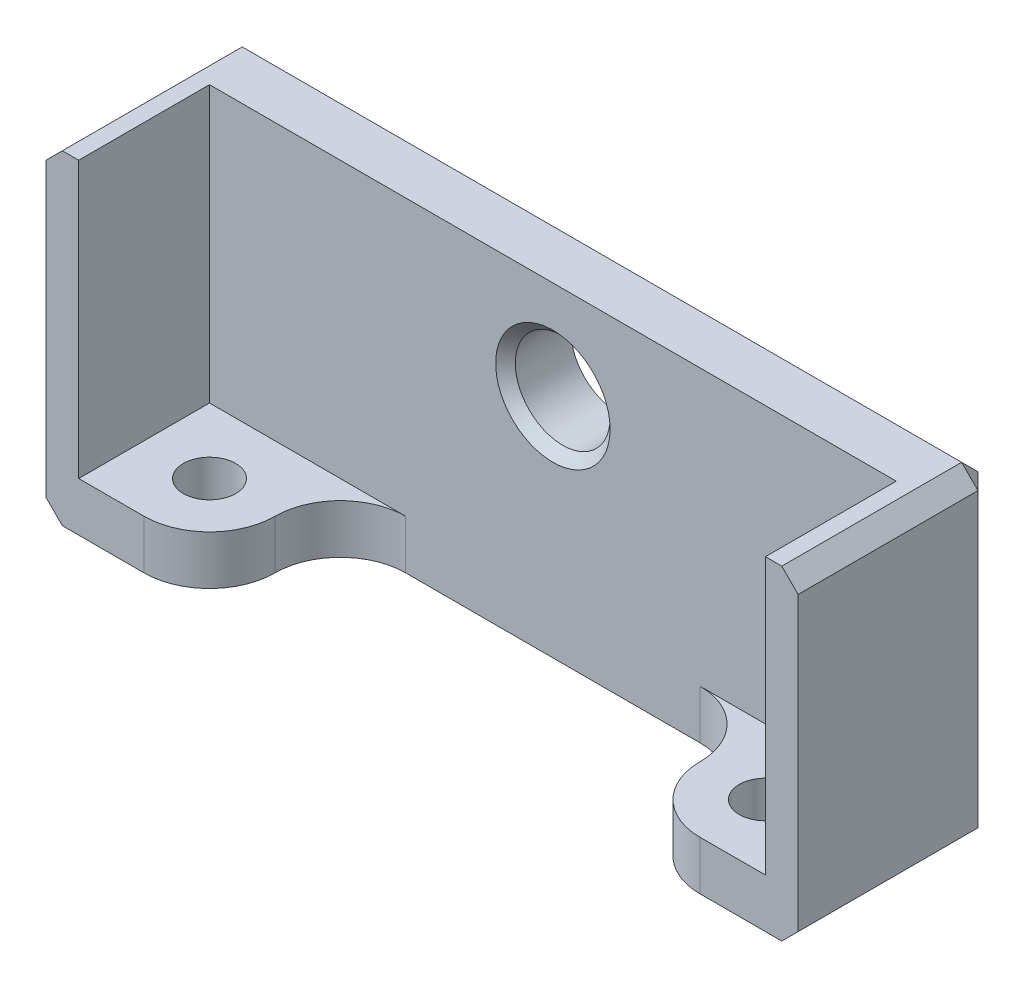
from build123d import *

# Parameters (mm, degrees)
SKETCH_1_R       = 2.9
EXTRUDE_1_DEPTH  = 4
CHAMFER_1_SIZE   = 0.6
SKETCH_3_W       = 12
SKETCH_3_H       = 19.86
EXTRUDE_2_DEPTH  = 2
SKETCH_4_W       = 10
SKETCH_4_H       = 12
SKETCH_4_R       = 1.6
EXTRUDE_3_DEPTH  = 3
FILLET_START     = -15
FILLET_2_DEPTH   = 4.14
FILLET_START_2   = -13.86
FILLET_2_2_DEPTH = 3
CHAMFER_4_SIZE   = 1


with BuildPart() as part:
    # 草图1 → 凸台-拉伸1 (new body)
    with BuildSketch(Plane.XY):
        Polygon((7.937253933, 6), (-21, 6), (-21, -13.86), (7.937253933, -13.86), (21, -13.86), (21, 6), align=None)
        Circle(SKETCH_1_R, mode=Mode.SUBTRACT)
    extrude(amount=EXTRUDE_1_DEPTH)

    # 倒角1
    chamfer_1_edges = [part.edges().sort_by_distance(p)[0] for p in [
        (-2.9, 0, 4),
    ]]
    chamfer(chamfer_1_edges, length=CHAMFER_1_SIZE)

    # 草图3 → 凸台-拉伸2 (add)
    with BuildSketch(Plane.ZY.offset(21)):
        with Locations((6, -3.93)):
            Rectangle(SKETCH_3_W, SKETCH_3_H)
    extrude_2 = extrude(amount=EXTRUDE_2_DEPTH)

    # 镜向1: 凸台-拉伸2 across plane
    add(extrude_2.mirror(Plane(origin=(0, 0, 0), x_dir=(0, 0, 1), z_dir=(1, 0, 0))))

    # 草图4 → 凸台-拉伸3 (add)
    # profile 1 of 2: a face of its own
    with BuildSketch(Plane.XZ.offset(13.86)):
        with Locations((-18, 6)):
            Rectangle(SKETCH_4_W, SKETCH_4_H)
        with Locations((-17, 8)):
            Circle(SKETCH_4_R, mode=Mode.SUBTRACT)
    # profile 2 of 2: a face of its own
    with BuildSketch(Plane.XZ.offset(13.86)):
        with Locations((18, 6)):
            Rectangle(SKETCH_4_W, SKETCH_4_H)
        with Locations(Location((17, 8, 0), (0, 0, 180))):
            Circle(SKETCH_4_R, mode=Mode.SUBTRACT)
    extrude(amount=-EXTRUDE_3_DEPTH)

    # 圆角2: read off the stored shape, not the designer's step
    # 圆角2 outline → 圆角2 (cut)
    with BuildSketch(Plane(origin=(0, 0, 0), x_dir=(1, 0, 0), z_dir=(0, 1, 0)).offset(FILLET_START)):
        with BuildLine():
            Line((13, -12), (17, -12))
            ThreePointArc((17, -12), (14.171572875, -10.828427125), (13, -8))
            Line((13, -8), (13, -12))
        make_face()
        with BuildLine():
            Line((-13, -12), (-13, -8))
            ThreePointArc((-13, -8), (-14.171572875, -10.828427125), (-17, -12))
            Line((-17, -12), (-13, -12))
        make_face()
    extrude(amount=FILLET_2_DEPTH, mode=Mode.SUBTRACT)

    # Fillet 2 2 outline → Fillet 2 2 (add)
    with BuildSketch(Plane(origin=(0, 0, 0), x_dir=(1, 0, 0), z_dir=(0, 1, 0)).offset(FILLET_START_2)):
        with BuildLine():
            ThreePointArc((-13, -8), (-11.828427125, -5.171572875), (-9, -4))
            Line((-9, -4), (-13, -4))
            Line((-13, -4), (-13, -8))
        make_face()
        with BuildLine():
            ThreePointArc((9, -4), (11.828427125, -5.171572875), (13, -8))
            Line((13, -8), (13, -4))
            Line((13, -4), (9, -4))
        make_face()
    extrude(amount=FILLET_2_2_DEPTH)

    # 倒角4
    chamfer_4_edges = [part.edges().sort_by_distance(p)[0] for p in [
        (-23, 6, 6),
        (-23, -3.93, 0),
        (-23, -13.86, 6),
        (23, -13.86, 6),
        (23, -3.93, 0),
        (23, 6, 6),
        (0, 6, 0),
        (0, -13.86, 0),
    ]]
    chamfer(chamfer_4_edges, length=CHAMFER_4_SIZE)


solid = part.part
